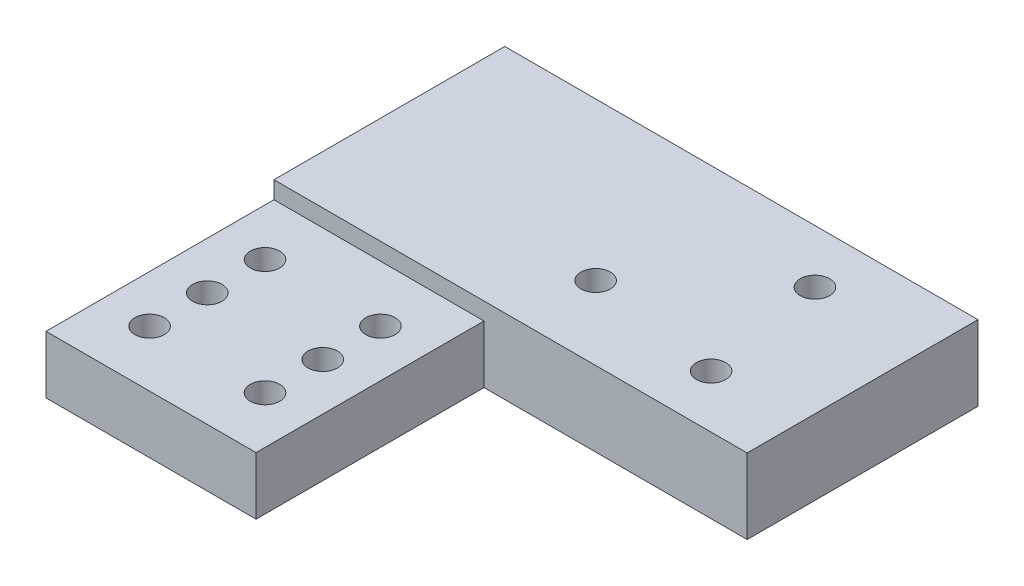
from build123d import *

# Parameters (mm, degrees)
SKETCH1_W                = 36.4
SKETCH1_H                = 39.5
SKETCH1_R                = 2.55
BOSS_EXTRUDE1_DEPTH      = 10
BOSS_EXTRUDE2_DEPTH      = 3
BOSS_EXTRUDE2_DEPTH_BACK = 10
SKETCH2_W                = 82
SKETCH2_H                = 40
F_5_0MM_DOWEL_HOLE1_D    = 5.1


with BuildPart() as part:
    # Sketch1 → Boss-Extrude1 (new body)
    with BuildSketch(Plane(origin=(0, 0, 0), x_dir=(1, 0, 0), z_dir=(0, 1, 0))):
        with Locations((18.2, 19.75)):
            Rectangle(SKETCH1_W, SKETCH1_H)
        with Locations((8.2, 29.75)):
            Circle(SKETCH1_R, mode=Mode.SUBTRACT)
        with Locations((28.2, 29.75)):
            Circle(SKETCH1_R, mode=Mode.SUBTRACT)
        with Locations((28.2, 19.75)):
            Circle(SKETCH1_R, mode=Mode.SUBTRACT)
        with Locations((28.2, 9.75)):
            Circle(SKETCH1_R, mode=Mode.SUBTRACT)
        with Locations((8.2, 19.75)):
            Circle(SKETCH1_R, mode=Mode.SUBTRACT)
        with Locations((8.2, 9.75)):
            Circle(SKETCH1_R, mode=Mode.SUBTRACT)
    extrude(amount=BOSS_EXTRUDE1_DEPTH)

    # Sketch2 → Boss-Extrude2 (add, two sides: drawn at the far end of the back side and taken through both)
    with BuildSketch(Plane(origin=(0, 10, 0), x_dir=(1, 0, 0), z_dir=(0, 1, 0)).offset(-BOSS_EXTRUDE2_DEPTH_BACK)):
        with Locations((41, 59.5)):
            Rectangle(SKETCH2_W, SKETCH2_H)
    extrude(amount=BOSS_EXTRUDE2_DEPTH + BOSS_EXTRUDE2_DEPTH_BACK)

    # Ø5.0mm Dowel Hole1 (through all)
    with Locations(Plane(origin=(42.996100309, 13, -52.245667008), x_dir=(0, 0, 1), z_dir=(0, 1, 0))):
        with Locations((0, 0), (-18, 20), (3.585786438, 23.585786437)):
            Hole(F_5_0MM_DOWEL_HOLE1_D / 2)


solid = part.part
